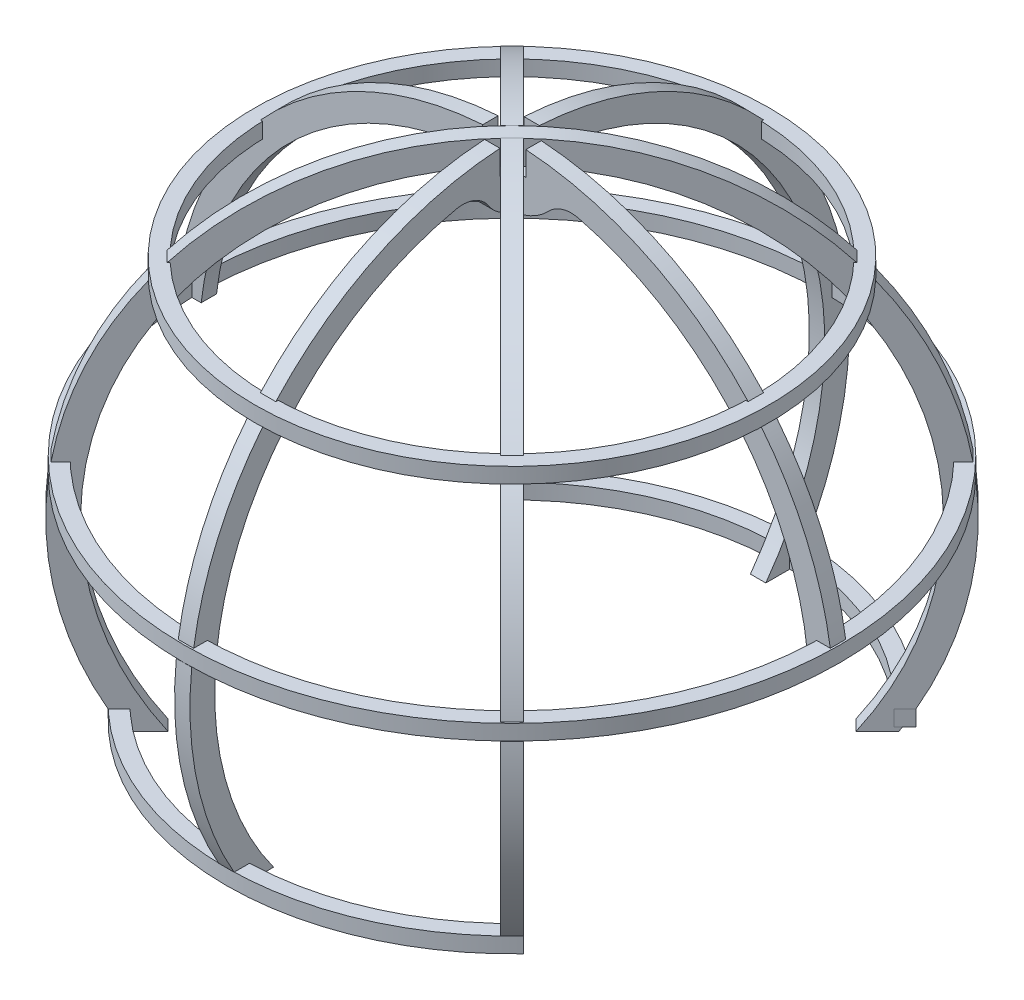
from build123d import *

# Parameters (mm, degrees)
BOSS_EXTRUDE1_DEPTH     = 1.5875
BOSS_EXTRUDE2_DEPTH     = 1.651
BOSS_EXTRUDE3_DEPTH     = 1.5875
CUT_EXTRUDE1_DEPTH      = 109.49223661
CUT_EXTRUDE1_DEPTH_BACK = 109.49223661
SKETCH6_R               = 53.031533709
SKETCH6_R_2             = 49.856533709
BOSS_EXTRUDE4_DEPTH     = 3.175
SKETCH7_R               = 67.597899539
SKETCH7_R_2             = 64.422899539
BOSS_EXTRUDE5_DEPTH     = 3.175
BOSS_EXTRUDE6_DEPTH     = 3.175
BOSS_EXTRUDE6_2_DEPTH   = 3.175
SKETCH9_W               = 3.176320208
SKETCH9_H               = 3.175
CUT_EXTRUDE2_DEPTH      = 119.640668604
SKETCH10_W              = 3.176220549
SKETCH10_H              = 3.175
CUT_EXTRUDE3_DEPTH      = 119.588623708
CUT_EXTRUDE4_DEPTH      = 119.213204755
BOSS_EXTRUDE7_DEPTH     = 1.5875
CUT_EXTRUDE5_DEPTH      = 119.424710604
SKETCH14_W              = 3.175
SKETCH14_H              = 3.175
CUT_EXTRUDE6_DEPTH      = 119.42965965
CUT_EXTRUDE7_DEPTH      = 119.424710604
FILLET1_R               = 6.35
FILLET2_R               = 6.35


with BuildPart() as part:
    # Sketch2 → Boss-Extrude1 (new, symmetric)
    with BuildSketch(Plane.XY):
        with BuildLine():
            Line((-67.597899539, 6.985), (-62.488646169, 6.985))
            ThreePointArc((-62.488646169, 6.985), (-45.925167756, 42.947643609), (-11.151782125, 61.881005813))
            ThreePointArc((-11.151782125, 61.881005813), (0, 55.257826974), (11.151782125, 61.881005813))
            ThreePointArc((11.151782125, 61.881005813), (45.925167756, 42.947643609), (62.488646169, 6.985))
            Line((62.488646169, 6.985), (67.597899539, 6.985))
            ThreePointArc((67.597899539, 6.985), (0, 67.957826974), (-67.597899539, 6.985))
        make_face()
    extrude(amount=BOSS_EXTRUDE1_DEPTH, both=True)

    # Sketch5 → Cut-Extrude1 (cut, two sides: drawn at the far end of the back side and taken through both)
    with BuildSketch(Plane.XY.offset(1.5875).offset(-CUT_EXTRUDE1_DEPTH_BACK)):
        with BuildLine():
            Line((4.445, 67.812301407), (4.445, 62.856147862))
            Line((4.445, 62.856147862), (-4.445, 62.856147862))
            Line((-4.445, 62.856147862), (-4.445, 67.812301407))
            ThreePointArc((-4.445, 67.812301407), (0, 67.957826974), (4.445, 67.812301407))
        make_face()
    extrude(amount=CUT_EXTRUDE1_DEPTH + CUT_EXTRUDE1_DEPTH_BACK, mode=Mode.SUBTRACT)

    # Sketch11 → Cut-Extrude4 (cut, through all)
    with BuildSketch(Plane(origin=(0, 0, -1.5875), x_dir=(-1, 0, 0), z_dir=(0, 0, -1))):
        with BuildLine():
            Line((67.597899539, 6.985), (64.403337093, 6.985))
            Line((64.403337093, 6.985), (64.403337093, 10.16))
            Line((64.403337093, 10.16), (67.19405217, 10.16))
            ThreePointArc((67.19405217, 10.16), (67.414669899, 8.574877808), (67.597899539, 6.985))
        make_face()
        with BuildLine():
            Line((52.982049888, 42.557826974), (49.831253218, 42.557826974))
            Line((49.831253218, 42.557826974), (49.831253218, 45.732826974))
            Line((49.831253218, 45.732826974), (50.267034764, 45.732826974))
            ThreePointArc((50.267034764, 45.732826974), (51.648945068, 44.166194317), (52.982049888, 42.557826974))
        make_face()
        with BuildLine():
            Line((-64.403337093, 10.16), (-67.19405217, 10.16))
            ThreePointArc((-67.19405217, 10.16), (-67.414669899, 8.574877808), (-67.597899539, 6.985))
            Line((-67.597899539, 6.985), (-64.403337093, 6.985))
            Line((-64.403337093, 6.985), (-64.403337093, 10.16))
        make_face()
        with BuildLine():
            Line((-49.831253218, 45.732826974), (-50.267034764, 45.732826974))
            ThreePointArc((-50.267034764, 45.732826974), (-51.648945068, 44.166194317), (-52.982049888, 42.557826974))
            Line((-52.982049888, 42.557826974), (-49.831253218, 42.557826974))
            Line((-49.831253218, 42.557826974), (-49.831253218, 45.732826974))
        make_face()
    extrude(amount=-CUT_EXTRUDE4_DEPTH, mode=Mode.SUBTRACT)

    # Sketch14 → Cut-Extrude6 (cut, through all)
    with BuildSketch(Plane(origin=(0, 0, -1.5875), x_dir=(-1, 0, 0), z_dir=(0, 0, -1))):
        with Locations((0, 61.268647862)):
            Rectangle(SKETCH14_W, SKETCH14_H)
    extrude(amount=-CUT_EXTRUDE6_DEPTH, mode=Mode.SUBTRACT)

    # Fillet2
    fillet2_edges = [part.edges().sort_by_distance(p)[0] for p in [
        (-11.151782125, 61.881005813, 0),
        (11.151782125, 61.881005813, 0),
    ]]
    fillet(fillet2_edges, radius=FILLET2_R)


with BuildPart() as body_2:
    # Sketch3 → Boss-Extrude2 (new, symmetric)
    with BuildSketch(Plane(origin=(0, 0, 0), x_dir=(0, 1, 0), z_dir=(0.7071067811865464, 0, -0.7071067811865488))):
        with BuildLine():
            Line((-37.1475, -50.731492869), (-37.1475, -56.928460782))
            ThreePointArc((-37.1475, -56.928460782), (31.642611455, -60.162542696), (67.956365658, -1.648869289))
            Line((67.956365658, -1.648869289), (65.42709674, -1.5875))
            Line((65.42709674, -1.5875), (65.42709674, 1.5875))
            Line((65.42709674, 1.5875), (67.957826974, 1.5875))
            ThreePointArc((67.957826974, 1.5875), (31.669773399, 60.148248987), (-37.1475, 56.928460782))
            Line((-37.1475, 56.928460782), (-37.1475, 50.731492869))
            ThreePointArc((-37.1475, 50.731492869), (28.441756692, 56.077514221), (62.877826974, 0))
            ThreePointArc((62.877826974, 0), (28.441756692, -56.077514221), (-37.1475, -50.731492869))
        make_face()
    extrude(amount=BOSS_EXTRUDE2_DEPTH, both=True)

    # Sketch9 → Cut-Extrude2 (cut, through all)
    with BuildSketch(Plane(origin=(1.167433296, 0, -1.167433296), x_dir=(-0.7071067811865487, 0, -0.7071067811865465), z_dir=(0.7071067811865465, 0, -0.7071067811865487))):
        with BuildLine():
            Line((64.401740535, 6.985), (64.401740535, 10.16))
            Line((64.401740535, 10.16), (67.212802377, 10.16))
            ThreePointArc((67.212802377, 10.16), (67.433358929, 8.57487649), (67.616537757, 6.985))
            Line((67.616537757, 6.985), (64.401740535, 6.985))
        make_face()
        with Locations((57.266999789, -35.56)):
            Rectangle(SKETCH9_W, SKETCH9_H)
        with BuildLine():
            Line((49.829189764, 42.557826974), (53.005827666, 42.557826974))
            ThreePointArc((53.005827666, 42.557826974), (51.673353143, 44.166174594), (50.292096201, 45.732826974))
            Line((50.292096201, 45.732826974), (49.829189764, 45.732826974))
            Line((49.829189764, 45.732826974), (49.829189764, 42.557826974))
        make_face()
        with Locations((-57.266999789, -35.56)):
            Rectangle(SKETCH9_W, SKETCH9_H)
        with BuildLine():
            Line((-64.401740535, 10.16), (-67.212802377, 10.16))
            ThreePointArc((-67.212802377, 10.16), (-67.433358929, 8.57487649), (-67.616537757, 6.985))
            Line((-67.616537757, 6.985), (-64.401740535, 6.985))
            Line((-64.401740535, 6.985), (-64.401740535, 10.16))
        make_face()
        with BuildLine():
            Line((-49.829189764, 45.732826974), (-50.292096201, 45.732826974))
            ThreePointArc((-50.292096201, 45.732826974), (-51.673353143, 44.166174594), (-53.005827666, 42.557826974))
            Line((-53.005827666, 42.557826974), (-49.829189764, 42.557826974))
            Line((-49.829189764, 42.557826974), (-49.829189764, 45.732826974))
        make_face()
    extrude(amount=-CUT_EXTRUDE2_DEPTH, mode=Mode.SUBTRACT)


with BuildPart() as body_3:
    # Sketch4 → Boss-Extrude3 (new, symmetric)
    with BuildSketch(Plane(origin=(0, 0, 0), x_dir=(0, 1, 0), z_dir=(-0.7071067811865512, 0, -0.7071067811865439))):
        with BuildLine():
            Line((-37.94125, -50.140628969), (-37.94125, -56.38020748))
            ThreePointArc((-37.94125, -56.38020748), (31.936353458, -59.986128187), (67.957826974, 0))
            ThreePointArc((67.957826974, 0), (31.936353458, 59.986128187), (-37.94125, 56.38020748))
            Line((-37.94125, 56.38020748), (-37.94125, 50.140628969))
            ThreePointArc((-37.94125, 50.140628969), (27.286626684, 56.648575703), (62.857783677, 1.5875))
            Line((62.857783677, 1.5875), (65.417826974, 1.5875))
            Line((65.417826974, 1.5875), (65.417826974, -1.5875))
            Line((65.417826974, -1.5875), (62.857783677, -1.5875))
            ThreePointArc((62.857783677, -1.5875), (27.286626684, -56.648575703), (-37.94125, -50.140628969))
        make_face()
    extrude(amount=BOSS_EXTRUDE3_DEPTH, both=True)

    # Sketch10 → Cut-Extrude3 (cut, through all)
    with BuildSketch(Plane(origin=(1.122532015, 0, 1.122532015), x_dir=(0.7071067811865438, 0, -0.7071067811865513), z_dir=(0.7071067811865513, 0, 0.7071067811865438))):
        with Locations((-57.268796634, -35.56)):
            Rectangle(SKETCH10_W, SKETCH10_H)
        with BuildLine():
            Line((-64.403337093, 10.16), (-67.19405217, 10.16))
            ThreePointArc((-67.19405217, 10.16), (-67.414669899, 8.574877808), (-67.597899539, 6.985))
            Line((-67.597899539, 6.985), (-64.403337093, 6.985))
            Line((-64.403337093, 6.985), (-64.403337093, 10.16))
        make_face()
        with BuildLine():
            Line((-49.831253218, 45.732826974), (-50.267034764, 45.732826974))
            ThreePointArc((-50.267034764, 45.732826974), (-51.648945068, 44.166194317), (-52.982049888, 42.557826974))
            Line((-52.982049888, 42.557826974), (-49.831253218, 42.557826974))
            Line((-49.831253218, 42.557826974), (-49.831253218, 45.732826974))
        make_face()
        with BuildLine():
            Line((49.831253218, 42.557826974), (52.982049888, 42.557826974))
            ThreePointArc((52.982049888, 42.557826974), (51.648945068, 44.166194317), (50.267034764, 45.732826974))
            Line((50.267034764, 45.732826974), (49.831253218, 45.732826974))
            Line((49.831253218, 45.732826974), (49.831253218, 42.557826974))
        make_face()
        with BuildLine():
            Line((64.403337093, 6.985), (67.597899539, 6.985))
            ThreePointArc((67.597899539, 6.985), (67.414669899, 8.574877808), (67.19405217, 10.16))
            Line((67.19405217, 10.16), (64.403337093, 10.16))
            Line((64.403337093, 10.16), (64.403337093, 6.985))
        make_face()
        with Locations((57.268796634, -35.56)):
            Rectangle(SKETCH10_W, SKETCH10_H)
    extrude(amount=-CUT_EXTRUDE3_DEPTH, mode=Mode.SUBTRACT)


with BuildPart() as body_4:
    # Sketch6 → Boss-Extrude4 (new body)
    with BuildSketch(Plane(origin=(0, 42.557826974, 0), x_dir=(1, 0, 0), z_dir=(0, 1, 0))):
        Circle(SKETCH6_R)
        Circle(SKETCH6_R_2, mode=Mode.SUBTRACT)
    extrude(amount=BOSS_EXTRUDE4_DEPTH)


with BuildPart() as body_5:
    # Sketch7 → Boss-Extrude5 (new body)
    with BuildSketch(Plane(origin=(0, 6.985, 0), x_dir=(-1, 0, 0), z_dir=(0, -1, 0))):
        Circle(SKETCH7_R)
        Circle(SKETCH7_R_2, mode=Mode.SUBTRACT)
    extrude(amount=-BOSS_EXTRUDE5_DEPTH)


with BuildPart() as body_6:
    # Sketch8 → Boss-Extrude6 (new body)
    with BuildSketch(Plane(origin=(0, -33.9725, 0), x_dir=(-1, 0, 0), z_dir=(0, -1, 0))):
        with BuildLine():
            Line((42.74065001, -40.495585979), (40.49472292, -38.24965889))
            ThreePointArc((40.49472292, -38.24965889), (-0.031763423, -55.70330314), (-40.538318405, -38.203451814))
            Line((-40.538318405, -38.203451814), (-42.784315964, -40.449449373))
            ThreePointArc((-42.784315964, -40.449449373), (-0.031762014, -58.878303629), (42.74065001, -40.495585979))
        make_face()
    extrude(amount=BOSS_EXTRUDE6_DEPTH)


with BuildPart() as body_7:
    # Sketch8 → Boss-Extrude6 2 (new body)
    with BuildSketch(Plane(origin=(0, -33.9725, 0), x_dir=(-1, 0, 0), z_dir=(0, -1, 0))):
        with BuildLine():
            ThreePointArc((-40.49472292, 38.24965889), (0.031763423, 55.70330314), (40.538318405, 38.203451814))
            Line((40.538318405, 38.203451814), (42.784315964, 40.449449373))
            ThreePointArc((42.784315964, 40.449449373), (0.031762014, 58.878303629), (-42.74065001, 40.495585979))
            Line((-42.74065001, 40.495585979), (-40.49472292, 38.24965889))
        make_face()
    extrude(amount=BOSS_EXTRUDE6_2_DEPTH)


with BuildPart() as body_8:
    # Sketch12 → Boss-Extrude7 (new, symmetric)
    with BuildSketch(Plane(origin=(0, 0, 0), x_dir=(0, 0, -1), z_dir=(1, 0, 0))):
        with BuildLine():
            Line((50.729466033, -37.1475), (56.917392499, -37.1475))
            ThreePointArc((56.917392499, -37.1475), (60.708849727, 30.560790076), (4.064, 67.845487906))
            Line((4.064, 67.845487906), (4.064, 62.744715987))
            ThreePointArc((4.064, 62.744715987), (0, 62.876191681), (-4.064, 62.744715987))
            Line((-4.064, 62.744715987), (-4.064, 67.845487906))
            ThreePointArc((-4.064, 67.845487906), (-60.708849727, 30.560790076), (-56.917392499, -37.1475))
            Line((-56.917392499, -37.1475), (-50.729466033, -37.1475))
            ThreePointArc((-50.729466033, -37.1475), (-57.696315015, 24.991012663), (-7.604371351, 62.414653861))
            ThreePointArc((-7.604371351, 62.414653861), (0, 55.257826974), (7.604371351, 62.414653861))
            ThreePointArc((7.604371351, 62.414653861), (57.696315015, 24.991012663), (50.729466033, -37.1475))
        make_face()
    extrude(amount=BOSS_EXTRUDE7_DEPTH, both=True)

    # Sketch13 → Cut-Extrude5 (cut, through all)
    with BuildSketch(Plane.ZY.offset(1.5875)):
        with BuildLine():
            Line((67.60721929, 6.985), (64.403337093, 6.985))
            Line((64.403337093, 6.985), (64.403337093, 10.16))
            Line((64.403337093, 10.16), (67.203427927, 10.16))
            ThreePointArc((67.203427927, 10.16), (67.424015062, 8.574877149), (67.60721929, 6.985))
        make_face()
        with BuildLine():
            Line((52.99394011, 42.557826974), (49.831253218, 42.557826974))
            Line((49.831253218, 42.557826974), (49.831253218, 45.732826974))
            Line((49.831253218, 45.732826974), (50.279567044, 45.732826974))
            ThreePointArc((50.279567044, 45.732826974), (51.661150551, 44.166184451), (52.99394011, 42.557826974))
        make_face()
        with BuildLine():
            Line((56.917392499, -37.1475), (55.680686359, -37.1475))
            Line((55.680686359, -37.1475), (55.680686359, -33.9725))
            Line((55.680686359, -33.9725), (58.867610525, -33.9725))
            ThreePointArc((58.867610525, -33.9725), (57.914263248, -35.57336697), (56.917392499, -37.1475))
        make_face()
        with BuildLine():
            Line((-55.680686359, -33.9725), (-58.867610525, -33.9725))
            ThreePointArc((-58.867610525, -33.9725), (-57.914263248, -35.57336697), (-56.917392499, -37.1475))
            Line((-56.917392499, -37.1475), (-55.680686359, -37.1475))
            Line((-55.680686359, -37.1475), (-55.680686359, -33.9725))
        make_face()
        with BuildLine():
            Line((-64.403337093, 10.16), (-67.203427927, 10.16))
            ThreePointArc((-67.203427927, 10.16), (-67.424015062, 8.574877149), (-67.60721929, 6.985))
            Line((-67.60721929, 6.985), (-64.403337093, 6.985))
            Line((-64.403337093, 6.985), (-64.403337093, 10.16))
        make_face()
        with BuildLine():
            Line((-49.831253218, 45.732826974), (-50.279567044, 45.732826974))
            ThreePointArc((-50.279567044, 45.732826974), (-51.661150551, 44.166184451), (-52.99394011, 42.557826974))
            Line((-52.99394011, 42.557826974), (-49.831253218, 42.557826974))
            Line((-49.831253218, 42.557826974), (-49.831253218, 45.732826974))
        make_face()
    extrude(amount=-CUT_EXTRUDE5_DEPTH, mode=Mode.SUBTRACT)

    # Sketch15 → Cut-Extrude7 (cut, through all)
    with BuildSketch(Plane(origin=(1.5875, 0, 0), x_dir=(0, 0, -1), z_dir=(1, 0, 0))):
        with BuildLine():
            Line((-1.5875, 59.681147862), (-1.5875, 55.425062602))
            ThreePointArc((-1.5875, 55.425062602), (0, 55.257826974), (1.5875, 55.425062602))
            Line((1.5875, 55.425062602), (1.5875, 59.681147862))
            Line((1.5875, 59.681147862), (-1.5875, 59.681147862))
        make_face()
    extrude(amount=-CUT_EXTRUDE7_DEPTH, mode=Mode.SUBTRACT)

    # Fillet1
    fillet1_edges = [body_8.edges().sort_by_distance(p)[0] for p in [
        (0, 62.414653861, -7.604371351),
        (0, 62.414653861, 7.604371351),
    ]]
    fillet(fillet1_edges, radius=FILLET1_R)


solid = Compound([part.part, body_2.part, body_3.part, body_4.part, body_5.part, body_6.part, body_7.part, body_8.part])
